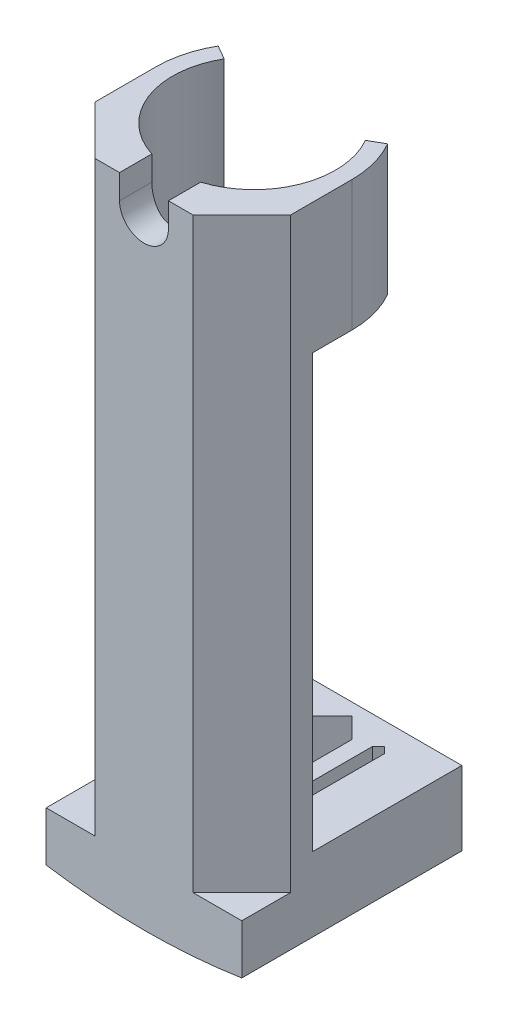
from build123d import *

# Parameters (mm, degrees)
BOSS_EXTRUDE1_DEPTH      = 56
BOSS_EXTRUDE2_DEPTH      = 16
BOSS_EXTRUDE3_DEPTH      = 3
BOSS_EXTRUDE3_DEPTH_BACK = 8
SKETCH4_W                = 24
SKETCH4_H                = 27
SKETCH5_W                = 28.405044576
SKETCH5_H                = 3.736732925
CUT_EXTRUDE2_DEPTH       = 78.826730626
CUT_EXTRUDE3_DEPTH       = 75.231058305


with BuildPart() as part:
    # Sketch2 → Boss-Extrude1 (new body)
    with BuildSketch(Plane(origin=(0, 0, 0), x_dir=(1, 0, 0), z_dir=(0, 1, 0))):
        with BuildLine():
            Line((12, -13.5), (-12, -13.5))
            Line((-12, -13.5), (-12, -4.795831523))
            Line((-12, -4.795831523), (-11, -4.795831523))
            ThreePointArc((-11, -4.795831523), (0, -12), (11, -4.795831523))
            Line((11, -4.795831523), (12, -4.795831523))
            Line((12, -4.795831523), (12, -13.5))
        make_face()
    extrude(amount=BOSS_EXTRUDE1_DEPTH)

    # Sketch3 → Boss-Extrude2 (add)
    with BuildSketch(Plane(origin=(0, 56, 0), x_dir=(1, 0, 0), z_dir=(0, 1, 0))):
        with BuildLine():
            Line((-12, -13.5), (12, -13.5))
            Line((12, -13.5), (12, 0))
            ThreePointArc((12, 0), (11.591109915, 3.105828541), (10.392304845, 6))
            Line((10.392304845, 6), (8.660254038, 5))
            ThreePointArc((8.660254038, 5), (0, -10), (-8.660254038, 5))
            Line((-8.660254038, 5), (-10.392304845, 6))
            ThreePointArc((-10.392304845, 6), (-11.591109915, 3.105828541), (-12, 0))
            Line((-12, 0), (-12, -13.5))
        make_face()
    extrude(amount=BOSS_EXTRUDE2_DEPTH)

    # Sketch4 → Boss-Extrude3 (add, two sides: drawn at the far end of the back side and taken through both)
    with BuildSketch(Plane(origin=(0, 0, 0), x_dir=(1, 0, 0), z_dir=(0, 1, 0)).offset(-BOSS_EXTRUDE3_DEPTH_BACK)):
        Rectangle(SKETCH4_W, SKETCH4_H)
        Polygon((0, -12), (2.5, -9.5), (2.5, 9.5), (0, 12), (-2.5, 9.5), (-2.5, -9.5), align=None, mode=Mode.SUBTRACT)
        Polygon((5.25, -10.790620927), (4.5, -10.040620927), (4.5, 10.040620927), (5.25, 10.790620927), (6, 10.040620927), (6, -10.040620927), align=None, mode=Mode.SUBTRACT)
        Polygon((-6, 10.040620927), (-6, -10.040620927), (-5.25, -10.790620927), (-4.5, -10.040620927), (-4.5, 10.040620927), (-5.25, 10.790620927), align=None, mode=Mode.SUBTRACT)
    extrude(amount=BOSS_EXTRUDE3_DEPTH + BOSS_EXTRUDE3_DEPTH_BACK)

    # Sketch5 → Cut-Revolve1 (revolve, cut)
    with BuildSketch(Plane(origin=(0, 0, 0), x_dir=(0, 0, -1), z_dir=(1, 0, 0))):
        with Locations((0.702522288, -8.868366462)):
            Rectangle(SKETCH5_W, SKETCH5_H)
    revolve(axis=Axis((0, 72, 13.5), (0, 0, -1)), mode=Mode.SUBTRACT)

    # Sketch6 → Cut-Extrude2 (cut, through all)
    with BuildSketch(Plane.XY.offset(13.5)):
        with BuildLine():
            Line((-3, 72), (-3, 69))
            ThreePointArc((-3, 69), (0, 66), (3, 69))
            Line((3, 69), (3, 72))
            Line((3, 72), (-3, 72))
        make_face()
    extrude(amount=-CUT_EXTRUDE2_DEPTH, mode=Mode.SUBTRACT)

    # Sketch7 → Cut-Extrude3 (cut, through all)
    with BuildSketch(Plane(origin=(0, 0, 0), x_dir=(1, 0, 0), z_dir=(0, 1, 0))):
        Polygon((6, -13.5), (12, -7.5), (12, -13.5), align=None)
        Polygon((-6, -13.5), (-12, -13.5), (-12, -7.5), align=None)
    extrude(amount=CUT_EXTRUDE3_DEPTH, mode=Mode.SUBTRACT)


solid = part.part
